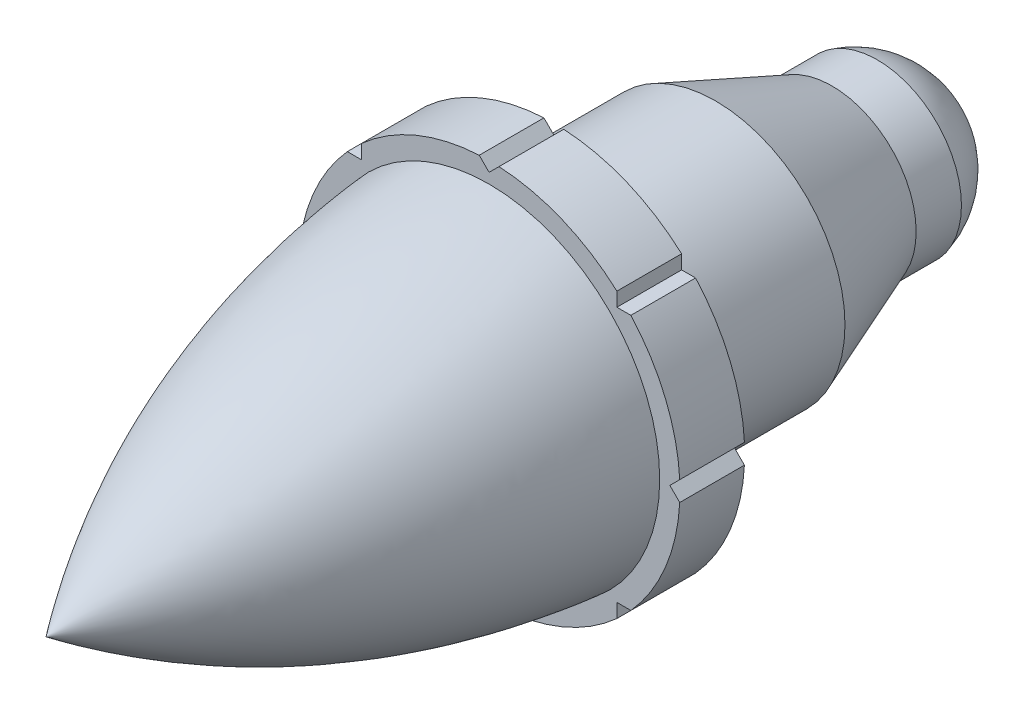
from build123d import *

# Parameters (mm, degrees)
DOME1_FACE_RADIUS = 3.302
DOME1_HEIGHT      = 2.54
SEEDCUT_DEPTH     = 21.698272826
CIRPATTERN1_COUNT = 8


# Read off the part's stored shape, not the designer's step: Cut-Revolve-Thin1
with BuildPart() as part:
    # Sketch1 → Revolve1 (revolve)
    with BuildSketch(Plane(origin=(0, 0, 0), x_dir=(0, 0, -1), z_dir=(1, 0, 0)), mode=Mode.PRIVATE) as revolve1_sk:
        Polygon((-2.54, 0), (-2.54, 7.493), (0, 7.493), (0, 5.08), (12.7, 5.08), (12.7, 0), align=None)
    revolve(revolve1_sk.sketch.rotate(Axis((0, 0, 11.886023166), (0, 0, -1)), 90), axis=Axis((0, 0, 11.886023166), (0, 0, -1)))

    # Cut-Revolve-Thin1 outline → Cut-Revolve-Thin1 (revolve, cut)
    with BuildSketch(Plane.XZ):
        Polygon((3.302, -10.922), (3.302, -12.7), (5.08, -12.7), (5.08, -6.35), align=None)
    revolve(axis=Axis((0, 0, 0), (0, 0, 1)), mode=Mode.SUBTRACT)

    # Dome1: a dome of height H over a round flat face of radius A is a cap of a sphere of radius (A * A + H * H) / (2 * H)
    dome1_r = (DOME1_FACE_RADIUS * DOME1_FACE_RADIUS + DOME1_HEIGHT * DOME1_HEIGHT) / (2 * DOME1_HEIGHT)
    dome1_base = Plane((0, 0, -12.7), z_dir=(0, 0, -1))
    with Locations(dome1_base.offset(DOME1_HEIGHT - dome1_r)):
        dome1_ball = Sphere(dome1_r, mode=Mode.PRIVATE)
    add(split(dome1_ball, bisect_by=dome1_base, keep=Keep.TOP, mode=Mode.PRIVATE))

    # Sketch4 → SeedCut (cut, through all)
    with BuildSketch(Plane.XY.offset(2.54)):
        with BuildLine():
            Line((0, 7.095048069), (0.387904496, 7.482952566))
            ThreePointArc((0.387904496, 7.482952566), (0, 7.493), (-0.387904496, 7.482952566))
            Line((-0.387904496, 7.482952566), (0, 7.095048069))
        make_face()
    seedcut = extrude(amount=-SEEDCUT_DEPTH, mode=Mode.SUBTRACT)

    # CirPattern1: SeedCut ×8 about axis
    cirpattern1_axis = Axis((0, 0, 0), (0, 0, 1))
    for i in range(1, CIRPATTERN1_COUNT):
        add(seedcut.rotate(cirpattern1_axis, i * 360 / CIRPATTERN1_COUNT), mode=Mode.SUBTRACT)


with BuildPart() as body_2:
    # Sketch2 → Revolve2 (revolve)
    with BuildSketch(Plane(origin=(0, 0, 0), x_dir=(0, 0, -1), z_dir=(1, 0, 0)), mode=Mode.PRIVATE) as revolve2_sk:
        with BuildLine():
            Line((-19.934319353, 0), (-2.68153526, 0))
            Line((-2.68153526, 0), (-2.54, 6.697096139))
            add(Edge.make_bspline(
                [(-2.54, 6.697096139), (-12.084947129, 5.788927202), (-19.934319353, 0)],
                knots=[0, 0, 0, 1, 1, 1], degree=2))
        make_face()
    revolve(revolve2_sk.sketch.rotate(Axis((0, 0, 11.886023166), (0, 0, 1)), 90), axis=Axis((0, 0, 11.886023166), (0, 0, 1)))


solid = Compound([part.part, body_2.part])
